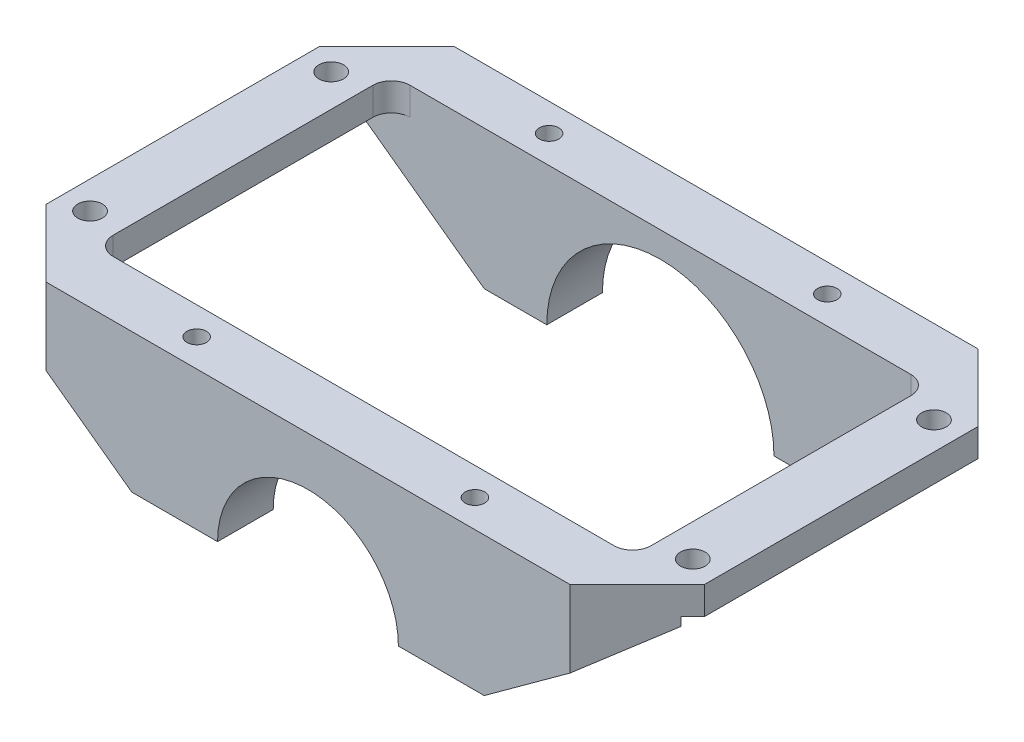
from build123d import *

# Parameters (mm, degrees)
SKETCH_1_W          = 142
SKETCH_1_H          = 88
SKETCH_1_W_2        = 116
SKETCH_1_H_2        = 64
EXTRUDE_1_DEPTH     = 30
CUT_EXTRUDE_1_DEPTH = 117.982904734
SKETCH_4_W          = 64
SKETCH_4_H          = 16.727272727
CUT_EXTRUDE_2_DEPTH = 152.657508881
FILLET_3_R          = 4
CHAMFER_2_SIZE      = 14.5
CUT_EXTRUDE_4_REACH = 118.983
SKETCH_8_R          = 19.5
CUT_EXTRUDE_5_REACH = 118.983
SKETCH_9_R          = 24.5
F_4_X_M5_D          = 4.2
F_4_X_M5_2_D        = 5.3


with BuildPart() as part:
    # 草图1 → 凸台-拉伸1 (new body)
    with BuildSketch(Plane(origin=(0, 0, 0), x_dir=(1, 0, 0), z_dir=(0, 1, 0))):
        Rectangle(SKETCH_1_W, SKETCH_1_H)
        Rectangle(SKETCH_1_W_2, SKETCH_1_H_2, mode=Mode.SUBTRACT)
    extrude(amount=-EXTRUDE_1_DEPTH)

    # 草图2 → 切除-拉伸1 (cut, through all)
    with BuildSketch(Plane.XY.offset(44)):
        Polygon((71, -6), (38, -30), (71, -30), align=None)
        Polygon((-71, -30), (-71, -6), (-38, -30), align=None)
    extrude(amount=-CUT_EXTRUDE_1_DEPTH, mode=Mode.SUBTRACT)

    # 草图4 → 切除-拉伸2 (cut, through all)
    with BuildSketch(Plane.ZY.offset(71)):
        with Locations((0, -14.363636364)):
            Rectangle(SKETCH_4_W, SKETCH_4_H)
    extrude(amount=-CUT_EXTRUDE_2_DEPTH, mode=Mode.SUBTRACT)

    # 圆角3
    fillet_3_edges = [part.edges().sort_by_distance(p)[0] for p in [
        (58, -3, -32),
        (58, -3, 32),
        (-58, -3, 32),
        (-58, -3, -32),
    ]]
    fillet(fillet_3_edges, radius=FILLET_3_R)

    # 倒角2
    # the kernel refuses this chamfer: 14.5 mm, written as the material it takes off along each edge
    with BuildSketch(Plane(origin=(71, 37.289403326, 44), x_dir=(-0.9996219169112966, 0, 0.027495876610586445), z_dir=(0, -1, 0)), Plane(origin=(-71, 37.289403326, 44), x_dir=(-0.02749587661058598, 0, -0.9996219169112966), z_dir=(0, -1, 0)), Plane(origin=(-71, 37.289403326, -44), x_dir=(0.9996219169112966, 0, -0.027495876610586455), z_dir=(0, -1, 0))) as chamfer_2_piece_1:
        Polygon((CHAMFER_2_SIZE * 0.999621916911, CHAMFER_2_SIZE * 0.0274958766106), (-CHAMFER_2_SIZE * 0.0274958766106, CHAMFER_2_SIZE * 0.999621916911), (0, 0), align=None)
    extrude(amount=80.578806651, mode=Mode.SUBTRACT)
    with BuildSketch(Plane(origin=(71, 37.289403326, -44), x_dir=(-0.9996219169112966, 0, -0.027495876610586455), z_dir=(0, -1, 0))) as chamfer_2_piece_2:
        Polygon((CHAMFER_2_SIZE * 0.999621916911, -CHAMFER_2_SIZE * 0.0274958766106), (-CHAMFER_2_SIZE * 0.0274958766106, -CHAMFER_2_SIZE * 0.999621916911), (0, 0), align=None)
    extrude(amount=80.578806651, mode=Mode.SUBTRACT)

    # 草图8 → 切除-拉伸4 (cut, up to next)
    with BuildSketch(Plane.XY.offset(44), mode=Mode.PRIVATE) as cut_extrude_4_sk1:
        with Locations((0, -30)):
            Circle(SKETCH_8_R)
    cut_extrude_4_tool1 = extrude(cut_extrude_4_sk1.sketch, amount=-CUT_EXTRUDE_4_REACH, mode=Mode.PRIVATE) & part.part
    add(cut_extrude_4_tool1.solids().sort_by_distance((0, -30, 44))[0], mode=Mode.SUBTRACT)

    # 草图9 → 切除-拉伸5 (cut, up to next)
    with BuildSketch(Plane(origin=(0, 0, -44), x_dir=(-1, 0, 0), z_dir=(0, 0, -1)), mode=Mode.PRIVATE) as cut_extrude_5_sk1:
        with Locations((0, -30)):
            Circle(SKETCH_9_R)
    cut_extrude_5_tool1 = extrude(cut_extrude_5_sk1.sketch, amount=-CUT_EXTRUDE_5_REACH, mode=Mode.PRIVATE) & part.part
    add(cut_extrude_5_tool1.solids().sort_by_distance((0, -30, -44))[0], mode=Mode.SUBTRACT)

    # 4 x M5 (through all)
    with Locations(Plane(origin=(0, 0, 0), x_dir=(-1, 0, 0), z_dir=(0, 1, 0))):
        with Locations((30, -38), (-30, -38), (-30, 38), (30, 38)):
            Hole(F_4_X_M5_D / 2)

    # 4 x M5 2 (through all)
    with Locations(Plane(origin=(0, 0, 0), x_dir=(-1, 0, 0), z_dir=(0, 1, 0))):
        with Locations((65, -26), (-65, -26), (65, 26), (-65, 26)):
            Hole(F_4_X_M5_2_D / 2)


solid = part.part
